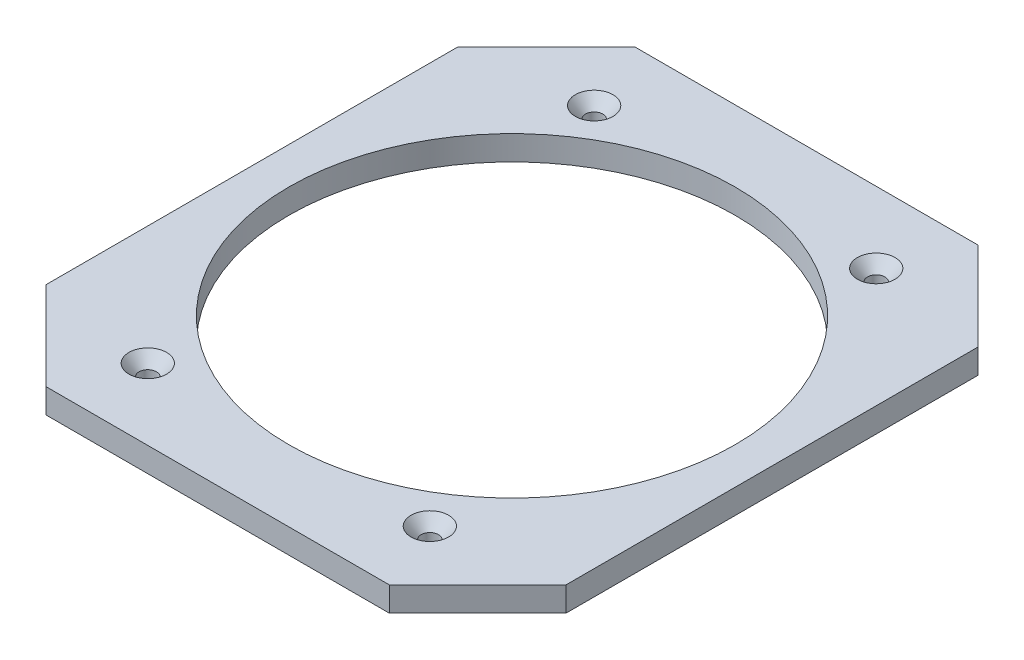
from build123d import *

# Parameters (mm, degrees)
BOSS_EXTRUDE1_DEPTH                            = 6.35
CSK_FOR_8_FLAT_HEAD_MACHINE_SCREW1_D           = 4.4958
CSK_FOR_8_FLAT_HEAD_MACHINE_SCREW1_CSINK_D     = 9.7576132
CSK_FOR_8_FLAT_HEAD_MACHINE_SCREW1_CSINK_ANGLE = 82
CIRPATTERN1_COUNT                              = 2
SKETCH4_R                                      = 57.785
CUT_EXTRUDE1_DEPTH                             = 102.869517521


with BuildPart() as part:
    # Sketch1 → Boss-Extrude1 (new body)
    with BuildSketch(Plane(origin=(0, 0, 0), x_dir=(1, 0, 0), z_dir=(0, 1, 0))):
        Polygon((-67.31, 53.34), (-44.45, 76.2), (44.45, 76.2), (67.31, 53.34), (67.31, -53.34), (44.45, -76.2), (-44.45, -76.2), (-67.31, -53.34), align=None)
    extrude(amount=BOSS_EXTRUDE1_DEPTH)

    # CSK for #8 Flat Head Machine Screw1 (through all)
    with Locations(Plane(origin=(0, 6.35, 0), x_dir=(-1, 0, 0), z_dir=(0, 1, 0))):
        with Locations((36.5125, -57.785), (-36.5125, -57.785)):
            csk_for_8_flat_head_machine_screw1 = CounterSinkHole(CSK_FOR_8_FLAT_HEAD_MACHINE_SCREW1_D / 2, CSK_FOR_8_FLAT_HEAD_MACHINE_SCREW1_CSINK_D / 2, counter_sink_angle=CSK_FOR_8_FLAT_HEAD_MACHINE_SCREW1_CSINK_ANGLE)

    # CirPattern1: CSK for #8 Flat Head Machine Screw1 ×2 about axis
    cirpattern1_axis = Axis((0, 0, 0), (0, 1, 0))
    for i in range(1, CIRPATTERN1_COUNT):
        add(csk_for_8_flat_head_machine_screw1.rotate(cirpattern1_axis, i * 360 / CIRPATTERN1_COUNT), mode=Mode.SUBTRACT)

    # Sketch4 → Cut-Extrude1 (cut, through all)
    with BuildSketch(Plane(origin=(0, 6.35, 0), x_dir=(1, 0, 0), z_dir=(0, 1, 0))):
        Circle(SKETCH4_R)
    extrude(amount=-CUT_EXTRUDE1_DEPTH, mode=Mode.SUBTRACT)


solid = part.part
